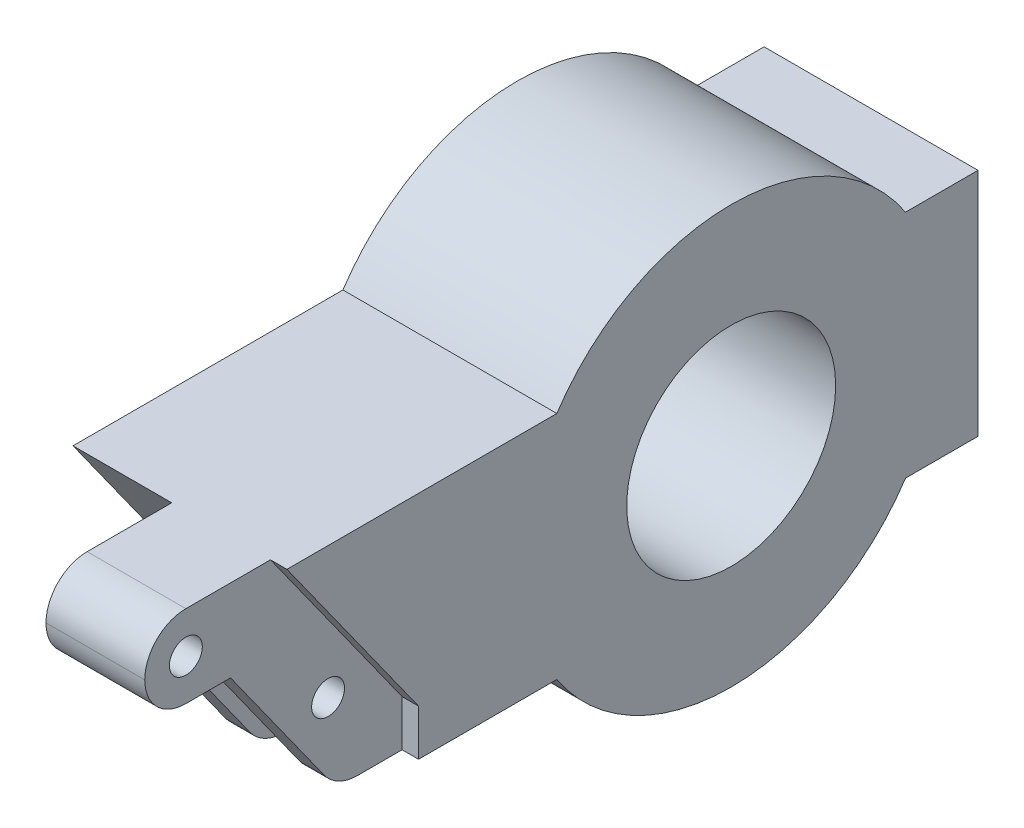
from build123d import *

# Parameters (mm, degrees)
SKETCH1_R           = 1
SKETCH1_R_2         = 6.35
BOSS_EXTRUDE1_DEPTH = 9
SKETCH2_W           = 6
SKETCH2_H           = 6.5
BOSS_EXTRUDE2_DEPTH = 5
CUT_EXTRUDE1_REACH  = 54.627
SKETCH3_R           = 1
FILLET1_R           = 2.5
SKETCH4_W           = 3
SKETCH4_H           = 8
CUT_EXTRUDE3_DEPTH  = 7.5
CUT_EXTRUDE8_DEPTH  = 6
CUT_EXTRUDE9_DEPTH  = 6
SKETCH9_W           = 49.64202669
SKETCH9_H           = 25.4
CUT_EXTRUDE11_DEPTH = 5


with BuildPart() as part:
    # Sketch1 → Boss-Extrude1 (new, symmetric)
    with BuildSketch(Plane(origin=(0, 0, 0), x_dir=(0, 0, -1), z_dir=(1, 0, 0))):
        with BuildLine():
            Line((-45.176360368, 3.046904516), (-38.74778894, -5.953095484))
            ThreePointArc((-38.74778894, -5.953095484), (-37.857409214, -6.722919107), (-36.713455262, -7))
            Line((-36.713455262, -7), (-25.596697599, -7))
            ThreePointArc((-25.596697599, -7), (-15, -12.7), (-4.403302401, -7))
            Line((-4.403302401, -7), (0, -7))
            Line((0, -7), (0, 7))
            Line((0, 7), (-4.403302401, 7))
            ThreePointArc((-4.403302401, 7), (-15, 12.7), (-25.596697599, 7))
            Line((-25.596697599, 7), (-43.14202669, 7))
            ThreePointArc((-43.14202669, 7), (-45.364945797, 5.643953952), (-45.176360368, 3.046904516))
        make_face()
        with Locations((-38.499169547, -2)):
            Circle(SKETCH1_R, mode=Mode.SUBTRACT)
        with Locations((-15, 0)):
            Circle(SKETCH1_R_2, mode=Mode.SUBTRACT)
    extrude(amount=BOSS_EXTRUDE1_DEPTH, both=True)

    # Sketch2 → Boss-Extrude2 (add)
    with BuildSketch(Plane(origin=(0, 7, 0), x_dir=(1, 0, 0), z_dir=(0, 1, 0))):
        with Locations((0, -46.39202669)):
            Rectangle(SKETCH2_W, SKETCH2_H)
    extrude(amount=-BOSS_EXTRUDE2_DEPTH)

    # Sketch3 → Cut-Extrude1 (cut, up to next)
    with BuildSketch(Plane(origin=(3, 0, 0), x_dir=(0, 0, -1), z_dir=(1, 0, 0)), mode=Mode.PRIVATE) as cut_extrude1_sk1:
        with Locations((-47.14202669, 4.5)):
            Circle(SKETCH3_R)
    cut_extrude1_tool1 = extrude(cut_extrude1_sk1.sketch, amount=-CUT_EXTRUDE1_REACH, mode=Mode.PRIVATE) & part.part
    add(cut_extrude1_tool1.solids().sort_by_distance((3, 4.5, 47.142027))[0], mode=Mode.SUBTRACT)

    # Fillet1
    fillet1_edges = [part.edges().sort_by_distance(p)[0] for p in [
        (0, 2, 49.64202669),
        (0, 7, 49.64202669),
    ]]
    fillet(fillet1_edges, radius=FILLET1_R - 0.0001)  # a hair under: the kernel refuses the full size

    # Sketch4 → Cut-Extrude3 (cut)
    with BuildSketch(Plane.XZ.offset(7)):
        with Locations((0, 39.99778894)):
            Rectangle(SKETCH4_W, SKETCH4_H)
    extrude(amount=-CUT_EXTRUDE3_DEPTH, mode=Mode.SUBTRACT)

    # Sketch6 → Cut-Extrude8 (cut)
    with BuildSketch(Plane(origin=(9, 0, 0), x_dir=(0, 0, -1), z_dir=(1, 0, 0))):
        Polygon((-48, 7), (-38, -7), (-34, -7), (-34, -4.2), (-42, 7), align=None)
    extrude(amount=-CUT_EXTRUDE8_DEPTH, mode=Mode.SUBTRACT)

    # Sketch8 → Cut-Extrude9 (cut)
    with BuildSketch(Plane.ZY.offset(9)):
        Polygon((38, -7), (48, 7), (42, 7), (34, -4.2), (34, -7), align=None)
    extrude(amount=-CUT_EXTRUDE9_DEPTH, mode=Mode.SUBTRACT)

    # Sketch9 → Cut-Extrude11 (cut)
    with BuildSketch(Plane(origin=(9, 0, 0), x_dir=(0, 0, -1), z_dir=(1, 0, 0))):
        with Locations((-24.821013345, 0)):
            Rectangle(SKETCH9_W, SKETCH9_H)
    extrude(amount=-CUT_EXTRUDE11_DEPTH, mode=Mode.SUBTRACT)


solid = part.part
